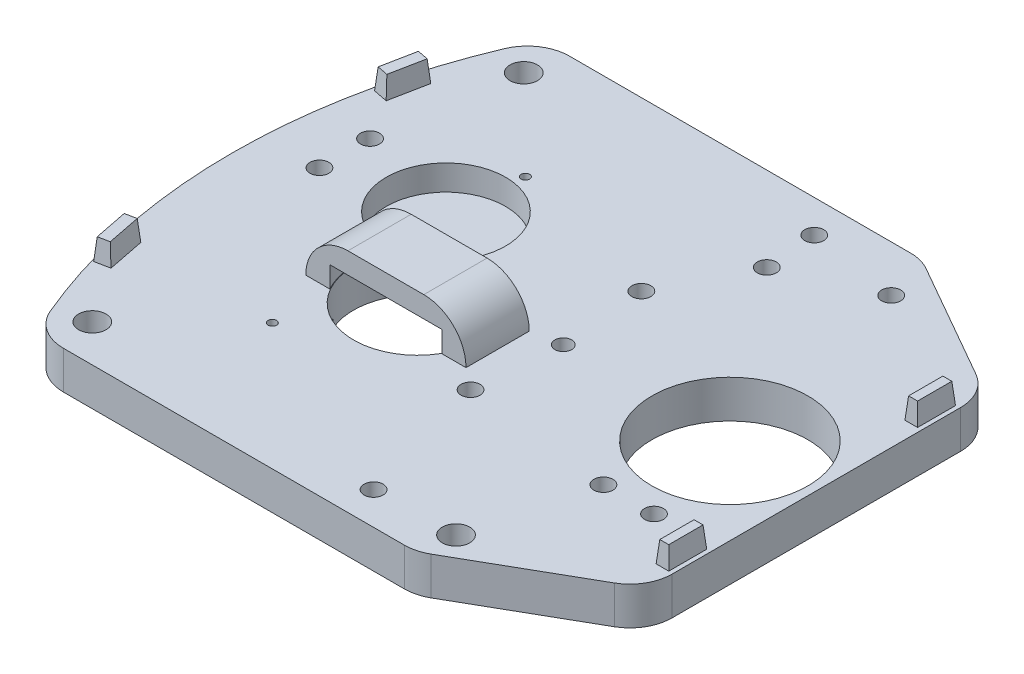
from build123d import *

# Parameters (mm, degrees)
SKETCH1_W                         = 125
SKETCH1_H                         = 120
TOP_BASE_DEPTH                    = 9
SKETCH5_R                         = 14.15
DRIVE_GEAR_HOLE_DEPTH             = 6
SKETCH28_R                        = 15.15
TWO_STAGE_GEAR_HOLE_DEPTH         = 174.51080658
SKETCH8_R                         = 18.5
XL320_FINGER_KNUCKLE_MOUNT_DEPTH  = 174.51080658
SKETCH26_R                        = 1
STRING_HOLES_DEPTH                = 174.51080658
XL320_MOUNT_HOLES_R               = 2.25
XL320_MOUNT_HOLES_M4_DEPTH        = 174.51080658
AX12_MOUNT_HOLES_R                = 2.25
AX12_MOUNT_HOLES_M4_DEPTH         = 174.51080658
NUTS_M4_DEPTH                     = 5
SKETCH34_R                        = 15
HOLES_FOR_M4_IN_FINGER_GEAR_DEPTH = 2
SKETCH31_W                        = 38
SKETCH31_H                        = 15
BOSS_EXTRUDE1_DEPTH               = 10
SKETCH32_R                        = 15.25
CUT_EXTRUDE5_DEPTH                = 5
SKETCH33_R                        = 1
CUT_EXTRUDE6_DEPTH                = 2.5
FILLET2_R                         = 10
CUT_EXTRUDE8_DEPTH                = 174.565549577
FILLET4_R                         = 10
SKETCH37_R                        = 3.25
CONNECT_HOLES_M6_DEPTH            = 10
SKETCH41_R                        = 2
CONNECT_TO_HOUSE_M4_DEPTH         = 174.565549577
SKETCH42_W                        = 3
SKETCH42_H                        = 9
HOUSING_FITS_DEPTH                = 5
HOUSING_FITS_DRAFT                = 5
HOUSING_FITS_PROFILE_2_DEPTH      = 5
HOUSING_FITS_PROFILE_2_DRAFT      = 5
HOUSING_FITS_PROFILE_3_DEPTH      = 5
HOUSING_FITS_PROFILE_3_DRAFT      = 5
HOUSING_FITS_PROFILE_4_DEPTH      = 5
HOUSING_FITS_PROFILE_4_DRAFT      = 5
SKETCH43_R                        = 1
M2_SHAFT_HOLE_DEPTH               = 2


with BuildPart() as part:
    # Sketch1 → Top_Base (new body)
    with BuildSketch(Plane(origin=(0, 0, 0), x_dir=(1, 0, 0), z_dir=(0, 1, 0))):
        with BuildLine():
            ThreePointArc((0, 120), (-13.654246239, 60), (0, 0))
            Line((0, 0), (0, 120))
        make_face()
        with Locations((62.5, 60)):
            Rectangle(SKETCH1_W, SKETCH1_H)
    extrude(amount=TOP_BASE_DEPTH)

    # Sketch5 → Drive_Gear_Hole (cut)
    with BuildSketch(Plane(origin=(0, 9, 0), x_dir=(1, 0, 0), z_dir=(0, 1, 0))):
        with Locations(Location((23.75, 73.41386581, 0), (0, 0, 270))):
            Circle(SKETCH5_R)
    extrude(amount=-DRIVE_GEAR_HOLE_DEPTH, mode=Mode.SUBTRACT)

    # Sketch28 → Two_Stage_Gear_Hole (cut, through all)
    with BuildSketch(Plane(origin=(0, 9, 0), x_dir=(1, 0, 0), z_dir=(0, 1, 0))):
        with Locations(Location((39.169567191, 51.25, 0), (0, 0, 270))):
            Circle(SKETCH28_R)
    extrude(amount=-TWO_STAGE_GEAR_HOLE_DEPTH, mode=Mode.SUBTRACT)

    # Sketch8 → XL320_Finger_Knuckle_Mount (cut, through all)
    with BuildSketch(Plane(origin=(0, 9, 0), x_dir=(1, 0, 0), z_dir=(0, 1, 0))):
        with Locations(Location((104.5, 60, 0), (0, 0, 270))):
            Circle(SKETCH8_R)
    extrude(amount=-XL320_FINGER_KNUCKLE_MOUNT_DEPTH, mode=Mode.SUBTRACT)

    # Sketch26 → String_Holes (cut, through all)
    with BuildSketch(Plane.XZ.offset(-9)):
        with Locations(Location((26, -30, 0), (0, 0, 270))):
            Circle(SKETCH26_R)
        with Locations(Location((26, -90, 0), (0, 0, 90))):
            Circle(SKETCH26_R)
    extrude(amount=STRING_HOLES_DEPTH, mode=Mode.SUBTRACT)

    # XL320_Mount_Holes → XL320_Mount_Holes_(M4) (cut, through all)
    with BuildSketch(Plane(origin=(0, 9, 0), x_dir=(1, 0, 0), z_dir=(0, 1, 0))):
        with Locations(Location((110.5, 36, 0), (0, 0, 270))):
            Circle(XL320_MOUNT_HOLES_R)
        with Locations(Location((98.5, 36, 0), (0, 0, 270))):
            Circle(XL320_MOUNT_HOLES_R)
        with Locations(Location((-0.25, 79.41386581, 0), (0, 0, 270))):
            Circle(XL320_MOUNT_HOLES_R)
        with Locations(Location((-0.25, 67.41386581, 0), (0, 0, 270))):
            Circle(XL320_MOUNT_HOLES_R)
    extrude(amount=-XL320_MOUNT_HOLES_M4_DEPTH, mode=Mode.SUBTRACT)

    # AX12_Mount_Holes → AX12_Mount_Holes_(M4) (cut, through all)
    with BuildSketch(Plane(origin=(0, 9, 0), x_dir=(1, 0, 0), z_dir=(0, 1, 0))):
        with Locations(Location((72.25, 112.25, 0), (0, 0, 270))):
            Circle(AX12_MOUNT_HOLES_R)
        with Locations(Location((63.25, 80.25, 0), (0, 0, 270))):
            Circle(AX12_MOUNT_HOLES_R)
        with Locations(Location((73.25, 100, 0), (0, 0, 270))):
            Circle(AX12_MOUNT_HOLES_R)
        with Locations(Location((93.75, 109, 0), (0, 0, 270))):
            Circle(AX12_MOUNT_HOLES_R)
        with Locations(Location((63.25, 39.75, 0), (0, 0, 270))):
            Circle(AX12_MOUNT_HOLES_R)
        with Locations(Location((72.25, 7.75, 0), (0, 0, 270))):
            Circle(AX12_MOUNT_HOLES_R)
    extrude(amount=-AX12_MOUNT_HOLES_M4_DEPTH, mode=Mode.SUBTRACT)

    # Sketch27 → Nuts_(M4) (cut)
    with BuildSketch(Plane.XZ):
        Polygon((110.5, -31.958548116), (107, -33.979274058), (107, -38.020725942), (110.5, -40.041451884), (114, -38.020725942), (114, -33.979274058), align=None)
        Polygon((98.5, -31.958548116), (95, -33.979274058), (95, -38.020725942), (98.5, -40.041451884), (102, -38.020725942), (102, -33.979274058), align=None)
        Polygon((3.25, -65.393139868), (-0.25, -63.372413926), (-3.75, -65.393139868), (-3.75, -69.434591752), (-0.25, -71.455317694), (3.25, -69.434591752), align=None)
        Polygon((-3.75, -77.393139868), (-3.75, -81.434591752), (-0.25, -83.455317694), (3.25, -81.434591752), (3.25, -77.393139868), (-0.25, -75.372413926), align=None)
    extrude(amount=-NUTS_M4_DEPTH, mode=Mode.SUBTRACT)

    # Sketch34 → Holes_For_M4_In_Finger_Gear (cut)
    with BuildSketch(Plane.XZ):
        with Locations((26, -30)):
            Circle(SKETCH34_R)
        with Locations(Location((26, -90, 0), (0, 0, 270))):
            Circle(SKETCH34_R)
    extrude(amount=-HOLES_FOR_M4_IN_FINGER_GEAR_DEPTH, mode=Mode.SUBTRACT)

    # Sketch31 → Boss-Extrude1 (add)
    with BuildSketch(Plane(origin=(0, 9, 0), x_dir=(1, 0, 0), z_dir=(0, 1, 0))):
        with Locations((39.169567191, 51.25)):
            Rectangle(SKETCH31_W, SKETCH31_H)
    extrude(amount=BOSS_EXTRUDE1_DEPTH)

    # Sketch32 → Cut-Extrude5 (cut)
    with BuildSketch(Plane.XZ.offset(-9)):
        with Locations((39.169567191, -51.25)):
            Circle(SKETCH32_R)
    extrude(amount=-CUT_EXTRUDE5_DEPTH, mode=Mode.SUBTRACT)

    # Sketch33 → Cut-Extrude6 (cut)
    with BuildSketch(Plane.XZ.offset(-14)):
        with Locations(Location((39.169567191, -51.25, 0), (0, 0, 270))):
            Circle(SKETCH33_R)
    extrude(amount=-CUT_EXTRUDE6_DEPTH, mode=Mode.SUBTRACT)

    # Fillet2
    fillet2_edges = [part.edges().sort_by_distance(p)[0] for p in [
        (58.169567191, 19, -51.25),
        (20.169567191, 19, -51.25),
    ]]
    fillet(fillet2_edges, radius=FILLET2_R - 0.0001)  # a hair under: the kernel refuses the full size

    # Sketch36 → Cut-Extrude8 (cut, through all)
    with BuildSketch(Plane(origin=(0, 9, 0), x_dir=(1, 0, 0), z_dir=(0, 1, 0))):
        Polygon((90, 120), (125, 100), (125, 120), align=None)
        Polygon((125, 0), (90, 0), (125, 20), align=None)
    extrude(amount=-CUT_EXTRUDE8_DEPTH, mode=Mode.SUBTRACT)

    # Fillet4
    fillet4_edges = [part.edges().sort_by_distance(p)[0] for p in [
        (90, 4.5, -120),
        (125, 4.5, -100),
        (125, 4.5, -20),
        (90, 4.5, 0),
        (0, 4.5, -120),
        (0, 4.5, 0),
    ]]
    fillet(fillet4_edges, radius=FILLET4_R)

    # Sketch37 → Connect_Holes_(M6) (cut)
    with BuildSketch(Plane(origin=(0, 9, 0), x_dir=(1, 0, 0), z_dir=(0, 1, 0))):
        with Locations(Location((4.459226107, 111.152938298, 0), (0, 0, 270))):
            Circle(SKETCH37_R)
        with Locations(Location((4.459226107, 8.847061702, 0), (0, 0, 270))):
            Circle(SKETCH37_R)
        with Locations(Location((91.344355629, 8.205555711, 0), (0, 0, 270))):
            Circle(SKETCH37_R)
    extrude(amount=-CONNECT_HOLES_M6_DEPTH, mode=Mode.SUBTRACT)

    # Sketch41 → Connect_To_House_(M4) (cut, through all)
    with BuildSketch(Plane(origin=(0, 9, 0), x_dir=(1, 0, 0), z_dir=(0, 1, 0))):
        with Locations(Location((65, 60, 0), (0, 0, 270))):
            Circle(SKETCH41_R)
    extrude(amount=-CONNECT_TO_HOUSE_M4_DEPTH, mode=Mode.SUBTRACT)


with BuildPart() as housing_fits_tool:
    # Sketch42 → Housing_Fits (with draft: the straight prism first)
    with BuildSketch(Plane(origin=(0, 9, 0), x_dir=(1, 0, 0), z_dir=(0, 1, 0))):
        with Locations((122.5, 30.5)):
            Rectangle(SKETCH42_W, SKETCH42_H)
    extrude(amount=HOUSING_FITS_DEPTH)
    # Housing_Fits: the draft: its side faces are tilted about the plane it starts from
    housing_fits_sides = [housing_fits_tool.faces().sort_by_distance(p)[0] for p in [
        (124, 11.5, -30.5),
        (122.5, 11.5, -35),
        (121, 11.5, -30.5),
        (122.5, 11.5, -26),
    ]]
    draft(housing_fits_sides, Plane(origin=(0, 9, 0), x_dir=(1, 0, 0), z_dir=(0, 1, 0)), HOUSING_FITS_DRAFT)


with BuildPart() as part_1:
    add(part.part)

    # Housing_Fits: add housing_fits_tool
    add(housing_fits_tool.part)


with BuildPart() as housing_fits_profile_2_tool:
    # Sketch42 → Housing_Fits profile 2 (with draft: the straight prism first)
    with BuildSketch(Plane(origin=(0, 9, 0), x_dir=(1, 0, 0), z_dir=(0, 1, 0))):
        Polygon((-9.533377338, 30.232888291), (-7.782151246, 21.404909633), (-4.349048435, 22.085942002), (-6.100274527, 30.91392066), align=None)
    extrude(amount=HOUSING_FITS_PROFILE_2_DEPTH)
    # Housing_Fits profile 2: the draft: its side faces are tilted about the plane it starts from
    housing_fits_profile_2_sides = [housing_fits_profile_2_tool.faces().sort_by_distance(p)[0] for p in [
        (-8.657764292, 11.5, -25.818898962),
        (-6.065599841, 11.5, -21.745425818),
        (-5.224661481, 11.5, -26.499931331),
        (-7.816825933, 11.5, -30.573404475),
    ]]
    draft(housing_fits_profile_2_sides, Plane(origin=(0, 9, 0), x_dir=(1, 0, 0), z_dir=(0, 1, 0)), HOUSING_FITS_PROFILE_2_DRAFT)


with BuildPart() as part_2:
    add(part_1.part)

    # Housing_Fits profile 2: add housing_fits_profile_2_tool
    add(housing_fits_profile_2_tool.part)


with BuildPart() as housing_fits_profile_3_tool:
    # Sketch42 → Housing_Fits profile 3 (with draft: the straight prism first)
    with BuildSketch(Plane(origin=(0, 9, 0), x_dir=(1, 0, 0), z_dir=(0, 1, 0))):
        Polygon((-4.349048435, 97.914057998), (-7.782151246, 98.595090367), (-9.533377338, 89.767111709), (-6.100274527, 89.08607934), align=None)
    extrude(amount=HOUSING_FITS_PROFILE_3_DEPTH)
    # Housing_Fits profile 3: the draft: its side faces are tilted about the plane it starts from
    housing_fits_profile_3_sides = [housing_fits_profile_3_tool.faces().sort_by_distance(p)[0] for p in [
        (-6.065599841, 11.5, -98.254574182),
        (-8.657764292, 11.5, -94.181101038),
        (-7.816825933, 11.5, -89.426595525),
        (-5.224661481, 11.5, -93.500068669),
    ]]
    draft(housing_fits_profile_3_sides, Plane(origin=(0, 9, 0), x_dir=(1, 0, 0), z_dir=(0, 1, 0)), HOUSING_FITS_PROFILE_3_DRAFT)


with BuildPart() as part_3:
    add(part_2.part)

    # Housing_Fits profile 3: add housing_fits_profile_3_tool
    add(housing_fits_profile_3_tool.part)


with BuildPart() as housing_fits_profile_4_tool:
    # Sketch42 → Housing_Fits profile 4 (with draft: the straight prism first)
    with BuildSketch(Plane(origin=(0, 9, 0), x_dir=(1, 0, 0), z_dir=(0, 1, 0))):
        with Locations((122.5, 89.5)):
            Rectangle(SKETCH42_W, SKETCH42_H)
    extrude(amount=HOUSING_FITS_PROFILE_4_DEPTH)
    # Housing_Fits profile 4: the draft: its side faces are tilted about the plane it starts from
    housing_fits_profile_4_sides = [housing_fits_profile_4_tool.faces().sort_by_distance(p)[0] for p in [
        (122.5, 11.5, -94),
        (121, 11.5, -89.5),
        (122.5, 11.5, -85),
        (124, 11.5, -89.5),
    ]]
    draft(housing_fits_profile_4_sides, Plane(origin=(0, 9, 0), x_dir=(1, 0, 0), z_dir=(0, 1, 0)), HOUSING_FITS_PROFILE_4_DRAFT)


with BuildPart() as part_4:
    add(part_3.part)

    # Housing_Fits profile 4: add housing_fits_profile_4_tool
    add(housing_fits_profile_4_tool.part)

    # Sketch43 → M2_Shaft_Hole (cut)
    with BuildSketch(Plane.XZ):
        with Locations(Location((39.169567191, -68.75, 0), (0, 0, 270))):
            Circle(SKETCH43_R)
    extrude(amount=-M2_SHAFT_HOLE_DEPTH, mode=Mode.SUBTRACT)


solid = part_4.part
